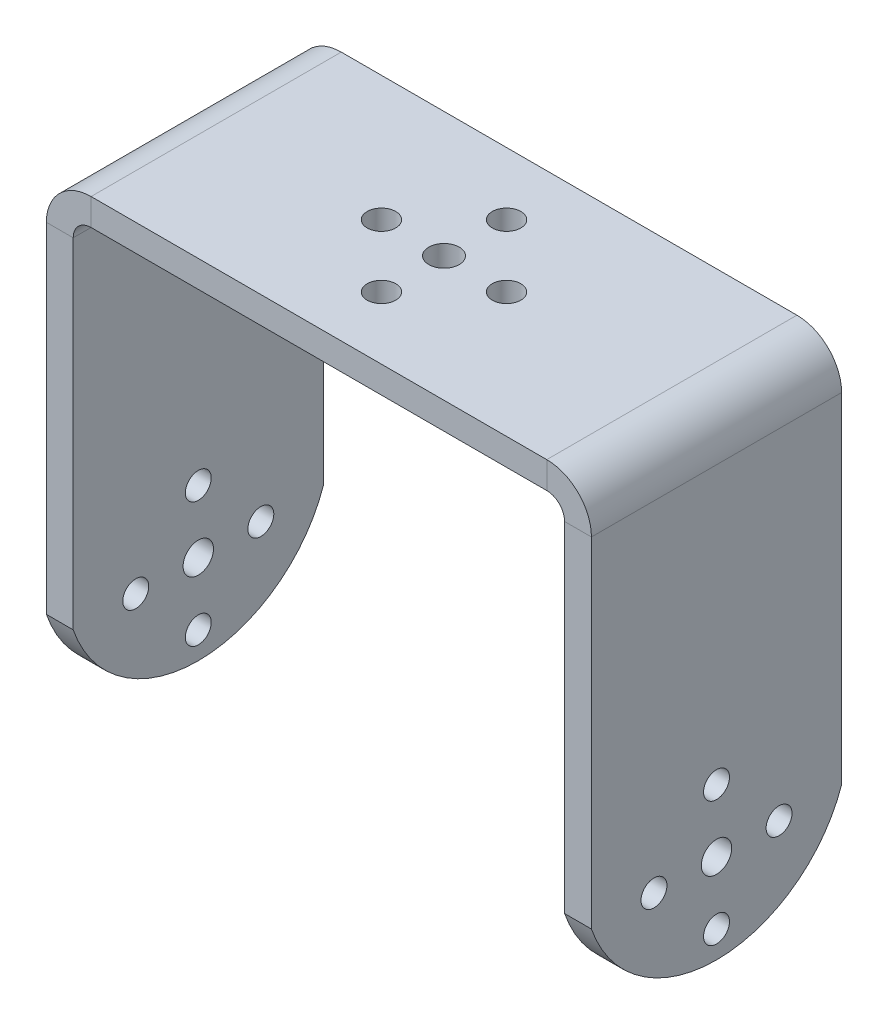
from build123d import *

# Parameters (mm, degrees)
SM_BASE_FLANGE_2_DEPTH = 28
SKETCH_10_R            = 1.45
SKETCH_10_R_2          = 1.7
CUT_EXTRUDE_1_DEPTH    = 73.725511342
SKETCH_12_R            = 1.6
SKETCH_12_R_2          = 1.7
CUT_EXTRUDE_3_DEPTH    = 4


# Sheet-metal steps are written as plain solids
with BuildPart() as part:
    # 草图1 → 基体-法兰2 (new body)
    with BuildSketch(Plane.XY):
        with BuildLine():
            Line((-27.5, -25), (-27.5, 23))
            ThreePointArc((-27.5, 23), (-26.914213562, 24.414213562), (-25.5, 25))
            Line((-25.5, 25), (25.5, 25))
            ThreePointArc((25.5, 25), (26.914213562, 24.414213562), (27.5, 23))
            Line((27.5, 23), (27.5, -25))
            Line((27.5, -25), (30.5, -25))
            Line((30.5, -25), (30.5, 23))
            ThreePointArc((30.5, 23), (29.035533906, 26.535533906), (25.5, 28))
            Line((25.5, 28), (-25.5, 28))
            ThreePointArc((-25.5, 28), (-29.035533906, 26.535533906), (-30.5, 23))
            Line((-30.5, 23), (-30.5, -25))
            Line((-30.5, -25), (-27.5, -25))
        make_face()
    extrude(amount=SM_BASE_FLANGE_2_DEPTH)

    # 草图10 → 切除-拉伸1 (cut, through all)
    with BuildSketch(Plane.ZY.offset(30.5)):
        with Locations(Location((7, -15, 0), (0, 0, 270))):
            Circle(SKETCH_10_R)
        with Locations(Location((14, -15, 0), (0, 0, 270))):
            Circle(SKETCH_10_R_2)
        with Locations(Location((21, -15, 0), (0, 0, 270))):
            Circle(SKETCH_10_R)
        with Locations(Location((14, -8, 0), (0, 0, 270))):
            Circle(SKETCH_10_R)
        with Locations(Location((14, -22, 0), (0, 0, 270))):
            Circle(SKETCH_10_R)
        with BuildLine():
            Line((0, -25), (14, -25))
            ThreePointArc((14, -25), (5.397674733, -22.243255374), (0, -15))
            Line((0, -15), (0, -25))
        make_face()
        with BuildLine():
            ThreePointArc((28, -15), (22.602325267, -22.243255374), (14, -25))
            Line((14, -25), (28, -25))
            Line((28, -25), (28, -15))
        make_face()
    extrude(amount=-CUT_EXTRUDE_1_DEPTH, mode=Mode.SUBTRACT)

    # 草图12 → 切除-拉伸3 (cut)
    with BuildSketch(Plane(origin=(0, 28, 0), x_dir=(1, 0, 0), z_dir=(0, 1, 0))):
        with Locations(Location((-7, -14, 0), (0, 0, 270))):
            Circle(SKETCH_12_R)
        with Locations(Location((0, -7, 0), (0, 0, 270))):
            Circle(SKETCH_12_R)
        with Locations(Location((7, -14, 0), (0, 0, 270))):
            Circle(SKETCH_12_R)
        with Locations(Location((0, -14, 0), (0, 0, 270))):
            Circle(SKETCH_12_R_2)
        with Locations(Location((0, -21, 0), (0, 0, 270))):
            Circle(SKETCH_12_R)
    extrude(amount=-CUT_EXTRUDE_3_DEPTH, mode=Mode.SUBTRACT)


solid = part.part
